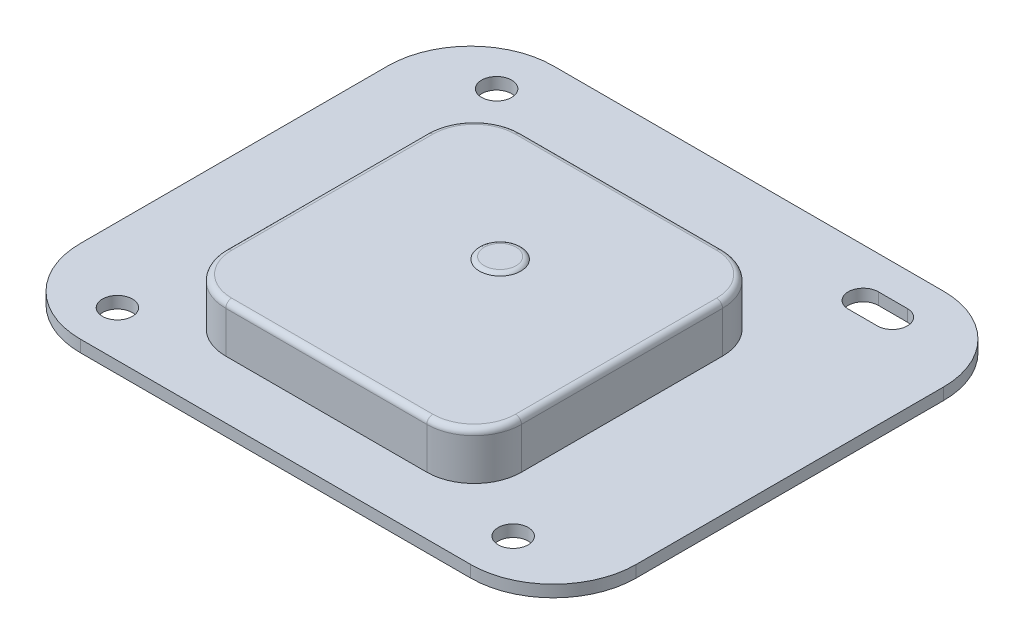
from build123d import *

# Parameters (mm, degrees)
SKETCH4_W           = 47
SKETCH4_H           = 40
SKETCH4_R           = 1.27
BOSS_EXTRUDE1_DEPTH = 1
FILLET1_R           = 7
SKETCH5_W           = 11.6
SKETCH5_H           = 15
BOSS_EXTRUDE2_DEPTH = 2.5
SKETCH6_W           = 5.6
SKETCH6_H           = 10.9
BOSS_EXTRUDE3_DEPTH = 4.5
SKETCH7_W           = 25
SKETCH7_H           = 25
BOSS_EXTRUDE4_DEPTH = 4
FILLET2_R           = 4
SKETCH8_R           = 1.75
BOSS_EXTRUDE5_DEPTH = 0.2
FILLET3_R           = 0.5
SKETCH9_W           = 8
SKETCH9_H           = 5.5
BOSS_EXTRUDE6_DEPTH = 2.4
FILLET4_R           = 0.5


with BuildPart() as part:
    # Sketch4 → Boss-Extrude1 (new body)
    with BuildSketch(Plane(origin=(0, 0, 0), x_dir=(1, 0, 0), z_dir=(0, 1, 0))):
        Rectangle(SKETCH4_W, SKETCH4_H)
        with Locations(Location((16.23, -16.13, 0), (0, 0, 270))):
            Circle(SKETCH4_R, mode=Mode.SUBTRACT)
        with Locations(Location((-17.23, -16.13, 0), (0, 0, 270))):
            Circle(SKETCH4_R, mode=Mode.SUBTRACT)
        with Locations(Location((-17.23, 15.93, 0), (0, 0, 270))):
            Circle(SKETCH4_R, mode=Mode.SUBTRACT)
        with BuildLine():
            Line((13.77, 14.66), (16.23, 14.66))
            ThreePointArc((16.23, 14.66), (17.5, 15.93), (16.23, 17.2))
            Line((16.23, 17.2), (13.77, 17.2))
            ThreePointArc((13.77, 17.2), (12.5, 15.93), (13.77, 14.66))
        make_face(mode=Mode.SUBTRACT)
    extrude(amount=BOSS_EXTRUDE1_DEPTH)

    # Fillet1
    fillet1_edges = [part.edges().sort_by_distance(p)[0] for p in [
        (23.5, 0.5, -20),
        (23.5, 0.5, 20),
        (-23.5, 0.5, 20),
        (-23.5, 0.5, -20),
    ]]
    fillet(fillet1_edges, radius=FILLET1_R)

    # Sketch5 → Boss-Extrude2 (add)
    with BuildSketch(Plane.XZ):
        with Locations((11, 3.6)):
            Rectangle(SKETCH5_W, SKETCH5_H)
    extrude(amount=BOSS_EXTRUDE2_DEPTH)

    # Sketch6 → Boss-Extrude3 (add)
    with BuildSketch(Plane.XZ):
        with Locations((-17.7, -4.55)):
            Rectangle(SKETCH6_W, SKETCH6_H)
    extrude(amount=BOSS_EXTRUDE3_DEPTH)

    # Sketch7 → Boss-Extrude4 (add)
    with BuildSketch(Plane(origin=(0, 1, 0), x_dir=(1, 0, 0), z_dir=(0, 1, 0))):
        with Locations((-0.6, -2.6)):
            Rectangle(SKETCH7_W, SKETCH7_H)
    extrude(amount=BOSS_EXTRUDE4_DEPTH)

    # Fillet2
    fillet2_edges = [part.edges().sort_by_distance(p)[0] for p in [
        (-13.1, 3, -9.9),
        (-13.1, 3, 15.1),
        (11.9, 3, 15.1),
        (11.9, 3, -9.9),
    ]]
    fillet(fillet2_edges, radius=FILLET2_R)

    # Sketch8 → Boss-Extrude5 (add)
    with BuildSketch(Plane(origin=(0, 5, 0), x_dir=(1, 0, 0), z_dir=(0, 1, 0))):
        with Locations(Location((-0.6, -0.4, 0), (0, 0, 270))):
            Circle(SKETCH8_R)
    extrude(amount=BOSS_EXTRUDE5_DEPTH)

    # Fillet3
    # the kernel refuses this fillet: 0.5 mm, written as the material it takes off along each edge
    with BuildSketch(Plane(origin=(-0.6, 5.2, 0.4), x_dir=(0, 0, 1), z_dir=(-1, 0, 0))) as fillet3_piece_1:
        with BuildLine():
            CenterArc((1.35, -0.5), FILLET3_R, 36.869897645, 53.130102355)
            Line((1.35, 0), (1.35, 0.01))
            Line((1.35, 0.01), (1.75, 0.01))
            Line((1.75, 0.01), (1.76, 0))
            ThreePointArc((1.76, 0), (1.76, -0.1), (1.758, -0.194))
            Line((1.758, -0.194), (1.75, -0.2))
        make_face()
    revolve(axis=Axis((-0.6, 5.2, 0.4), (0, 1, 0)), mode=Mode.SUBTRACT)

    # Sketch9 → Boss-Extrude6 (add)
    with BuildSketch(Plane.XZ):
        with Locations((-1, -17.95)):
            Rectangle(SKETCH9_W, SKETCH9_H)
    extrude(amount=BOSS_EXTRUDE6_DEPTH)

    # Fillet4
    fillet4_edges = [part.edges().sort_by_distance(p)[0] for p in [
        (-13.1, 5, 2.6),
        (-0.6, 5, -9.9),
        (-0.6, 5, 15.1),
        (11.9, 5, 2.6),
        (10.728427125, 5, -8.728427125),
        (10.728427125, 5, 13.928427125),
        (-11.928427125, 5, 13.928427125),
        (-11.928427125, 5, -8.728427125),
    ]]
    fillet(fillet4_edges, radius=FILLET4_R)


solid = part.part
